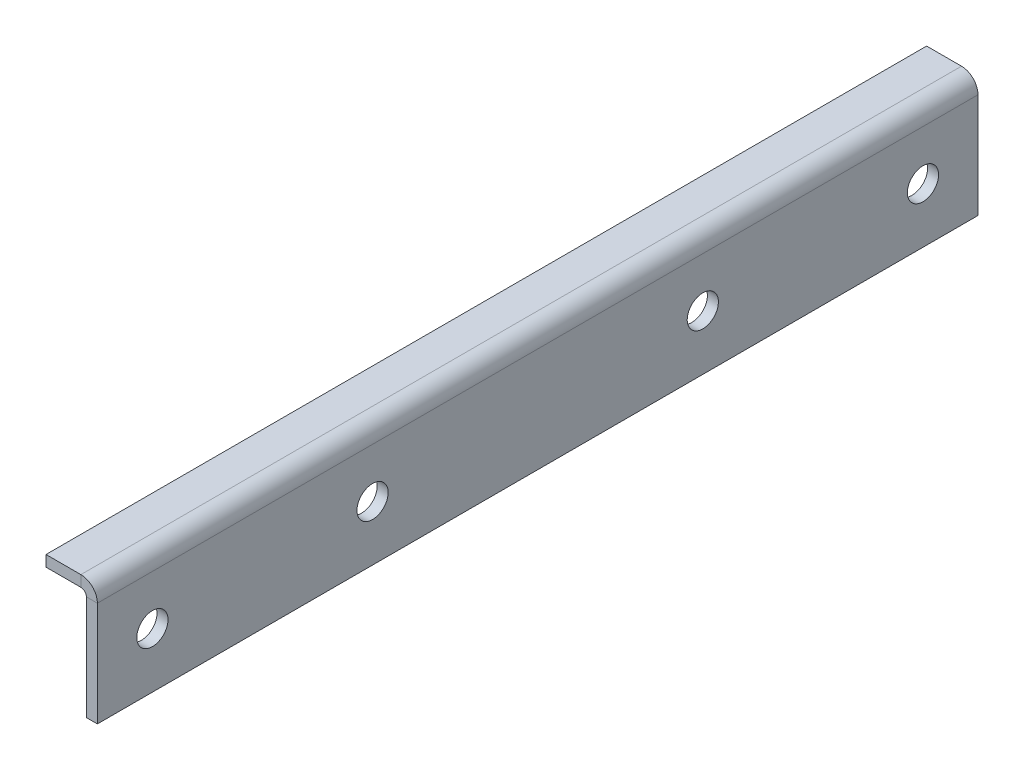
from build123d import *

# Parameters (mm, degrees)
SKETCH_1_W                       = 3
SKETCH_1_H                       = 30
SM_BASE_FLANGE_1_DEPTH           = 240
SKETCH_6_R                       = 4.25
CUT_EXTRUDE_1_DEPTH              = 242.886336944
SM_EDGE_FLANGE_1_STRIP_W         = 15
SM_EDGE_FLANGE_1_STRIP_H         = 3
SM_EDGE_FLANGE_1_STRIP_CUT_DEPTH = 240
SM_EDGE_FLANGE_1_DEPTH           = 240


# Sheet-metal steps are written as plain solids
with BuildPart() as part:
    # Sketch 1 → Базовая кромка1 (new body)
    with BuildSketch(Plane.XY):
        with Locations((1.5, -15)):
            Rectangle(SKETCH_1_W, SKETCH_1_H)
    extrude(amount=-SM_BASE_FLANGE_1_DEPTH)

    # Эскиз6 → Вырез-Вытянуть1 (cut, through all)
    with BuildSketch(Plane(origin=(3, 0, 0), x_dir=(0, 0, -1), z_dir=(1, 0, 0))):
        with Locations(Location((225, -15, 0), (0, 0, 90))):
            Circle(SKETCH_6_R)
        with Locations(Location((165, -15, 0), (0, 0, 90))):
            Circle(SKETCH_6_R)
        with Locations(Location((75, -15, 0), (0, 0, 90))):
            Circle(SKETCH_6_R)
        with Locations(Location((15, -15, 0), (0, 0, 90))):
            Circle(SKETCH_6_R)
    extrude(amount=-CUT_EXTRUDE_1_DEPTH, mode=Mode.SUBTRACT)

    # Ребро-кромка1 strip (across the edge) → Ребро-кромка1 strip cut (cut)
    with BuildSketch(Plane(origin=(0, 0, 0), x_dir=(0, -1, 0), z_dir=(0, 0, -1))):
        with Locations((-6, -1.5)):
            Rectangle(SM_EDGE_FLANGE_1_STRIP_W, SM_EDGE_FLANGE_1_STRIP_H)
    extrude(amount=SM_EDGE_FLANGE_1_STRIP_CUT_DEPTH, mode=Mode.SUBTRACT)

    # Ребро-кромка1 section (across the edge) → Ребро-кромка1 (add)
    with BuildSketch(Plane(origin=(0, 0, 0), x_dir=(0, -1, 0), z_dir=(0, 0, -1))):
        with BuildLine():
            Line((-3, 1.5), (-3, 11))
            Line((-3, 11), (0, 11))
            Line((0, 11), (0, 1.5))
            ThreePointArc((0, 1.5), (0.439339828, 0.439339828), (1.5, 0))
            Line((1.5, 0), (1.5, -3))
            ThreePointArc((1.5, -3), (-1.681980515, -1.681980515), (-3, 1.5))
        make_face()
    extrude(amount=SM_EDGE_FLANGE_1_DEPTH)


solid = part.part
